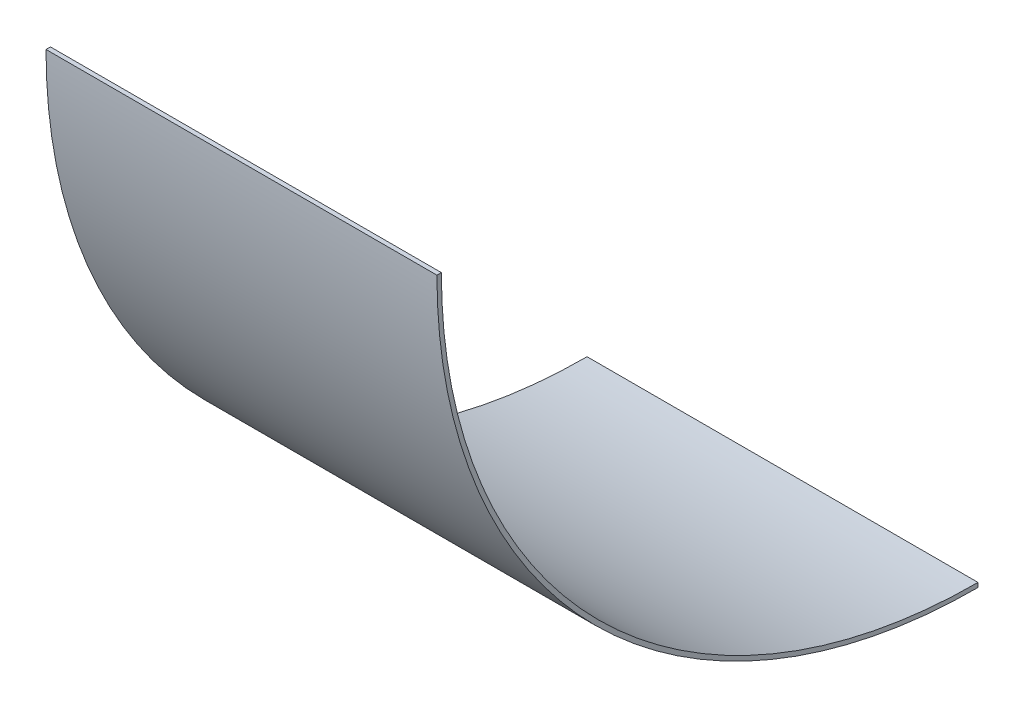
from build123d import *

# Parameters (mm, degrees)
EXTRUDE_THIN1_DEPTH = 139.7


with BuildPart() as part:
    # Sketch1 → Extrude-Thin1 (new body)
    with BuildSketch(Plane(origin=(0, 0, 0), x_dir=(0, 0, -1), z_dir=(1, 0, 0))):
        with BuildLine():
            ThreePointArc((-191.77, 0), (-135.601867428, -135.601867428), (0, -191.77))
            Line((0, -191.77), (0, -193.3575))
            ThreePointArc((0, -193.3575), (-136.724399443, -136.724399443), (-193.3575, 0))
            Line((-193.3575, 0), (-191.77, 0))
        make_face()
    extrude(amount=EXTRUDE_THIN1_DEPTH)


solid = part.part
